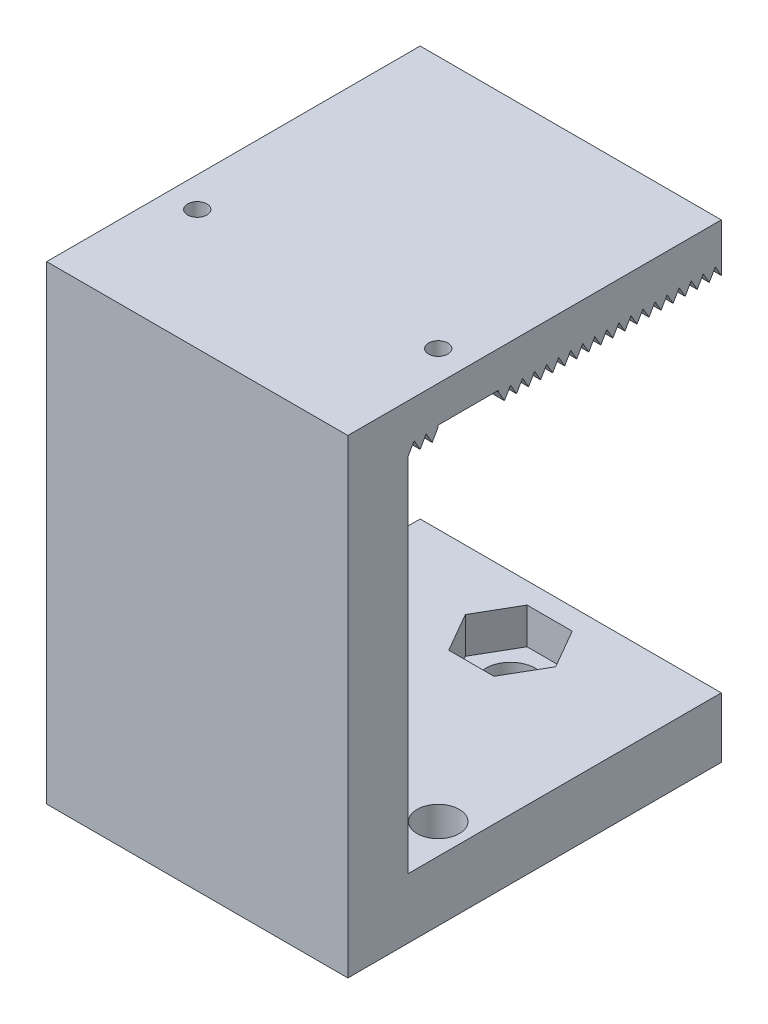
from build123d import *

# Parameters (mm, degrees)
SKETCH1_W               = 50
SKETCH1_H               = 62
BOSS_EXTRUDE1_DEPTH     = 8
SKETCH2_R               = 1.6
CUT_EXTRUDE1_DEPTH      = 41.620192023
SKETCH4_W               = 50
SKETCH4_H               = 10
BOSS_EXTRUDE2_DEPTH     = 60
SKETCH5_W               = 50
SKETCH5_H               = 62
BOSS_EXTRUDE3_DEPTH     = 10
SKETCH6_R               = 4.1
CUT_EXTRUDE3_DEPTH      = 10
CUT_EXTRUDE4_START      = -50
CUT_EXTRUDE4_DEPTH      = 50
CUT_EXTRUDE6_DEPTH      = 6
CUT_EXTRUDE7_START      = -8
SKETCH10_W              = 10
SKETCH10_H              = 10
CUT_EXTRUDE7_DEPTH      = 2
CUT_EXTRUDE8_DEPTH      = 83.280009723
CUT_EXTRUDE8_DEPTH_BACK = 3
SKETCH11_R              = 3.5


# Read off the part's stored shape, not the designer's step: Cut-Extrude4
with BuildPart() as part:
    # Sketch1 → Boss-Extrude1 (new body)
    with BuildSketch(Plane(origin=(0, 0, 0), x_dir=(1, 0, 0), z_dir=(0, 1, 0))):
        Rectangle(SKETCH1_W, SKETCH1_H)
    extrude(amount=BOSS_EXTRUDE1_DEPTH)

    # Sketch2 → Cut-Extrude1 (cut, through all)
    with BuildSketch(Plane(origin=(0, 8, 0), x_dir=(1, 0, 0), z_dir=(0, 1, 0))):
        with Locations(Location((-20, -11, 0), (0, 0, 270))):
            Circle(SKETCH2_R)
        with Locations(Location((20, -11, 0), (0, 0, 270))):
            Circle(SKETCH2_R)
    extrude(amount=-CUT_EXTRUDE1_DEPTH, mode=Mode.SUBTRACT)

    # Sketch4 → Boss-Extrude2 (add)
    with BuildSketch(Plane.XZ):
        with Locations((0, 26)):
            Rectangle(SKETCH4_W, SKETCH4_H)
    extrude(amount=BOSS_EXTRUDE2_DEPTH)

    # Sketch5 → Boss-Extrude3 (add)
    with BuildSketch(Plane.XZ.offset(60)):
        Rectangle(SKETCH5_W, SKETCH5_H)
    extrude(amount=BOSS_EXTRUDE3_DEPTH)

    # Sketch6 → Cut-Extrude3 (cut)
    with BuildSketch(Plane.XZ.offset(70)):
        with Locations(Location((0, -21, 0), (0, 0, 270))):
            Circle(SKETCH6_R)
    extrude(amount=-CUT_EXTRUDE3_DEPTH, mode=Mode.SUBTRACT)

    # Cut-Extrude4 outline → Cut-Extrude4 (cut)
    with BuildSketch(Plane.ZY.offset(25).offset(CUT_EXTRUDE4_START)):
        Polygon((20, 1.732050808), (19, 0), (21, 0), align=None)
        Polygon((18, 1.732050808), (17, 0), (19, 0), align=None)
        Polygon((16, 1.732050808), (15, 0), (17, 0), align=None)
        Polygon((14, 1.732050808), (13, 0), (15, 0), align=None)
        Polygon((-31, 0), (-29, 0), (-30, 1.732050808), align=None)
        Polygon((-29, 0), (-27, 0), (-28, 1.732050808), align=None)
        Polygon((-27, 0), (-25, 0), (-26, 1.732050808), align=None)
        Polygon((-25, 0), (-23, 0), (-24, 1.732050808), align=None)
        Polygon((-23, 0), (-21, 0), (-22, 1.732050808), align=None)
        Polygon((-21, 0), (-19, 0), (-20, 1.732050808), align=None)
        Polygon((-19, 0), (-17, 0), (-18, 1.732050808), align=None)
        Polygon((-17, 0), (-15, 0), (-16, 1.732050808), align=None)
        Polygon((-15, 0), (-13, 0), (-14, 1.732050808), align=None)
        Polygon((-13, 0), (-11, 0), (-12, 1.732050808), align=None)
        Polygon((-11, 0), (-9, 0), (-10, 1.732050808), align=None)
        Polygon((-9, 0), (-7, 0), (-8, 1.732050808), align=None)
        Polygon((-7, 0), (-5, 0), (-6, 1.732050808), align=None)
        Polygon((-5, 0), (-3, 0), (-4, 1.732050808), align=None)
        Polygon((-3, 0), (-1, 0), (-2, 1.732050808), align=None)
        Polygon((-1, 0), (1, 0), (0, 1.732050808), align=None)
        Polygon((1, 0), (3, 0), (2, 1.732050808), align=None)
        Polygon((3, 0), (5, 0), (4, 1.732050808), align=None)
        Polygon((5, 0), (7, 0), (6, 1.732050808), align=None)
        Polygon((7, 0), (9, 0), (8, 1.732050808), align=None)
        Polygon((9, 0), (11, 0), (10, 1.732050808), align=None)
        Polygon((13, 0), (12, 1.732050808), (11, 0), align=None)
    extrude(amount=CUT_EXTRUDE4_DEPTH, mode=Mode.SUBTRACT)

    # Sketch9 → Cut-Extrude6 (cut)
    with BuildSketch(Plane(origin=(0, -60, 0), x_dir=(1, 0, 0), z_dir=(0, 1, 0))):
        Polygon((3.75, 14.504809472), (7.5, 21), (3.75, 27.495190528), (-3.75, 27.495190528), (-7.5, 21), (-3.75, 14.504809472), align=None)
    extrude(amount=-CUT_EXTRUDE6_DEPTH, mode=Mode.SUBTRACT)

    # Sketch10 → Cut-Extrude7 (cut)
    with BuildSketch(Plane(origin=(0, 8, 0), x_dir=(1, 0, 0), z_dir=(0, 1, 0)).offset(CUT_EXTRUDE7_START)):
        with Locations((20, -11)):
            Rectangle(SKETCH10_W, SKETCH10_H)
        with Locations((-20, -11)):
            Rectangle(SKETCH10_W, SKETCH10_H)
    extrude(amount=CUT_EXTRUDE7_DEPTH, mode=Mode.SUBTRACT)

    # Sketch11 → Cut-Extrude8 (cut, two sides: drawn at the far end of the back side and taken through both)
    with BuildSketch(Plane.XZ.offset(-2).offset(-CUT_EXTRUDE8_DEPTH_BACK)):
        with Locations(Location((-20, 11, 0), (0, 0, 90))):
            Circle(SKETCH11_R)
        with Locations(Location((20, 11, 0), (0, 0, 90))):
            Circle(SKETCH11_R)
    extrude(amount=CUT_EXTRUDE8_DEPTH + CUT_EXTRUDE8_DEPTH_BACK, mode=Mode.SUBTRACT)


solid = part.part
